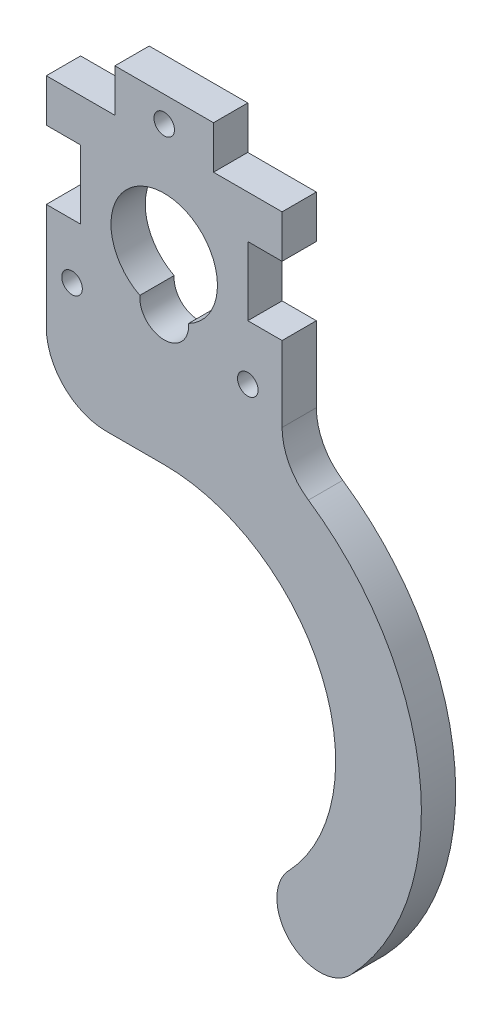
from build123d import *

# Parameters (mm, degrees)
SKETCH1_R           = 1.2
BOSS_EXTRUDE1_DEPTH = 4
FILLET1_R           = 7
FILLET2_START       = -1
FILLET2_DEPTH       = 6


with BuildPart() as part:
    # Sketch1 → Boss-Extrude1 (new body)
    with BuildSketch(Plane.XY):
        with BuildLine():
            Line((8, 37.42), (8, 32.42))
            Line((8, 32.42), (0, 32.42))
            Line((0, 32.42), (0, 27.42))
            Line((0, 27.42), (4, 27.42))
            Line((4, 27.42), (4, 19.42))
            Line((4, 19.42), (0, 19.42))
            Line((0, 19.42), (0, 0))
            Line((0, 0), (13.75, 0))
            ThreePointArc((13.75, 0), (32.824339015, -13.98588401), (25.221528727, -36.383040886))
            Line((25.221528727, -36.383040886), (30.957293091, -44.574561329))
            ThreePointArc((30.957293091, -44.574561329), (43.681938755, -17.980336071), (27.5, 6.66341126))
            Line((27.5, 6.66341126), (27.5, 19.42))
            Line((27.5, 19.42), (23.5, 19.42))
            Line((23.5, 19.42), (23.5, 27.42))
            Line((23.5, 27.42), (27.5, 27.42))
            Line((27.5, 27.42), (27.5, 32.42))
            Line((27.5, 32.42), (19.5, 32.42))
            Line((19.5, 32.42), (19.5, 37.42))
            Line((19.5, 37.42), (8, 37.42))
        make_face()
        with Locations((3, 13)):
            Circle(SKETCH1_R, mode=Mode.SUBTRACT)
        with BuildLine():
            ThreePointArc((16.590873036, 15.687904348), (13.75, 12.61), (10.909126964, 15.687904348))
            ThreePointArc((10.909126964, 15.687904348), (13.75, 27.42), (16.590873036, 15.687904348))
        make_face(mode=Mode.SUBTRACT)
        with Locations((13.75, 34.42)):
            Circle(SKETCH1_R, mode=Mode.SUBTRACT)
        with Locations((23.5, 13)):
            Circle(SKETCH1_R, mode=Mode.SUBTRACT)
    extrude(amount=BOSS_EXTRUDE1_DEPTH)

    # Fillet1
    fillet1_edges = [part.edges().sort_by_distance(p)[0] for p in [
        (27.5, 6.66341126, 2),
        (0, 0, 2),
    ]]
    fillet(fillet1_edges, radius=FILLET1_R)

    # Fillet2: read off the stored shape, not the designer's step
    # Fillet2 outline → Fillet2 (cut)
    with BuildSketch(Plane.XY.offset(FILLET2_START)):
        with BuildLine():
            ThreePointArc((30.957293091, -44.574561329), (33.340121642, -42.720632343), (35.524547437, -40.636595745))
            add(Edge.make_bspline(
                [(35.524547437, -40.636595745), (34.55329691, -41.661403369), (33.063664011, -42.522816758), (31.099164619, -42.770231906), (29.107575632, -41.932891027), (27.799695976, -40.065045303)],
                knots=[0, 0, 0, 0, 0, 0, 0.550510257, 0.550510257, 0.550510257, 0.550510257, 0.550510257, 0.550510257], degree=5, weights=[1, 0.779795897, 0.620204103, 0.521224617, 0.48285744, 0.505102572]))
            Line((27.799695976, -40.065045303), (30.957293091, -44.574561329))
        make_face()
        with BuildLine():
            Line((25.221528727, -36.383040886), (27.799695976, -40.065045303))
            add(Edge.make_bspline(
                [(27.799695976, -40.065045303), (26.814281677, -38.657727837), (26.550577461, -37.082538129), (26.869269697, -35.66327749), (27.512411311, -34.553258967), (28.266364958, -33.757730497)],
                knots=[0.550510257, 0.550510257, 0.550510257, 0.550510257, 0.550510257, 0.550510257, 1, 1, 1, 1, 1, 1], degree=5, weights=[0.505102572, 0.523265646, 0.581836926, 0.680816412, 0.820204103, 1]))
            ThreePointArc((28.266364958, -33.757730497), (26.810081095, -35.147088229), (25.221528727, -36.383040886))
        make_face()
    extrude(amount=FILLET2_DEPTH, mode=Mode.SUBTRACT)


solid = part.part
